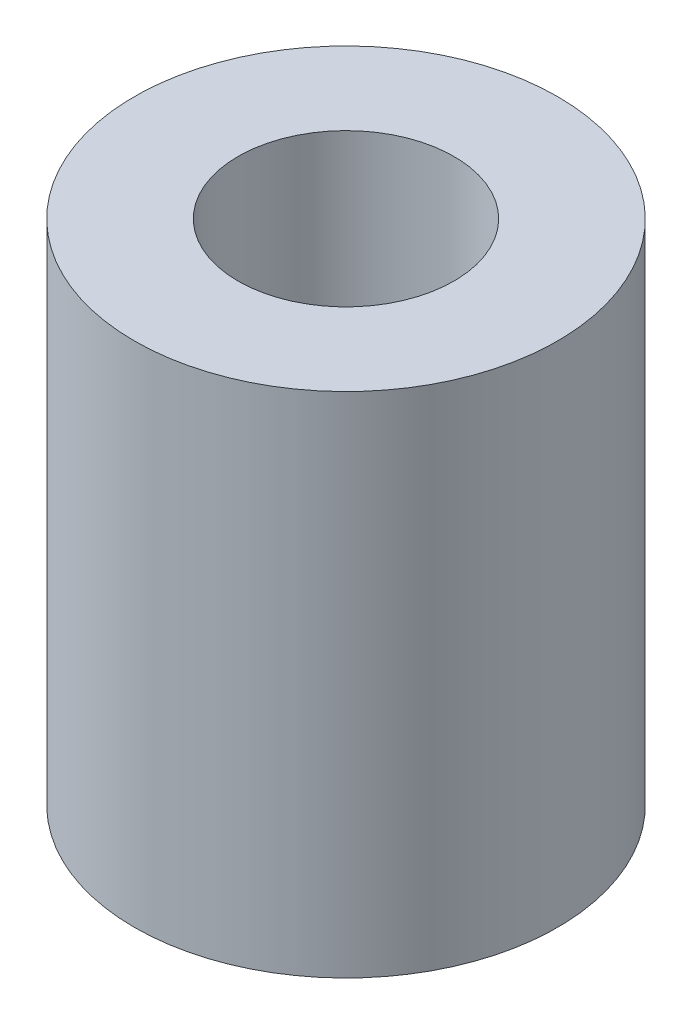
from build123d import *

# Parameters (mm, degrees)
SKETCH1_R           = 7.9375
BOSS_EXTRUDE1_DEPTH = 19.05
SKETCH3_R           = 4.05
CUT_EXTRUDE2_DEPTH  = 23.11131639


with BuildPart() as part:
    # Sketch1 → Boss-Extrude1 (new body)
    with BuildSketch(Plane(origin=(0, 0, 0), x_dir=(1, 0, 0), z_dir=(0, 1, 0))):
        Circle(SKETCH1_R)
    extrude(amount=BOSS_EXTRUDE1_DEPTH)

    # Sketch3 → Cut-Extrude2 (cut, through all)
    with BuildSketch(Plane(origin=(0, 19.05, 0), x_dir=(1, 0, 0), z_dir=(0, 1, 0))):
        Circle(SKETCH3_R)
    extrude(amount=-CUT_EXTRUDE2_DEPTH, mode=Mode.SUBTRACT)


solid = part.part
